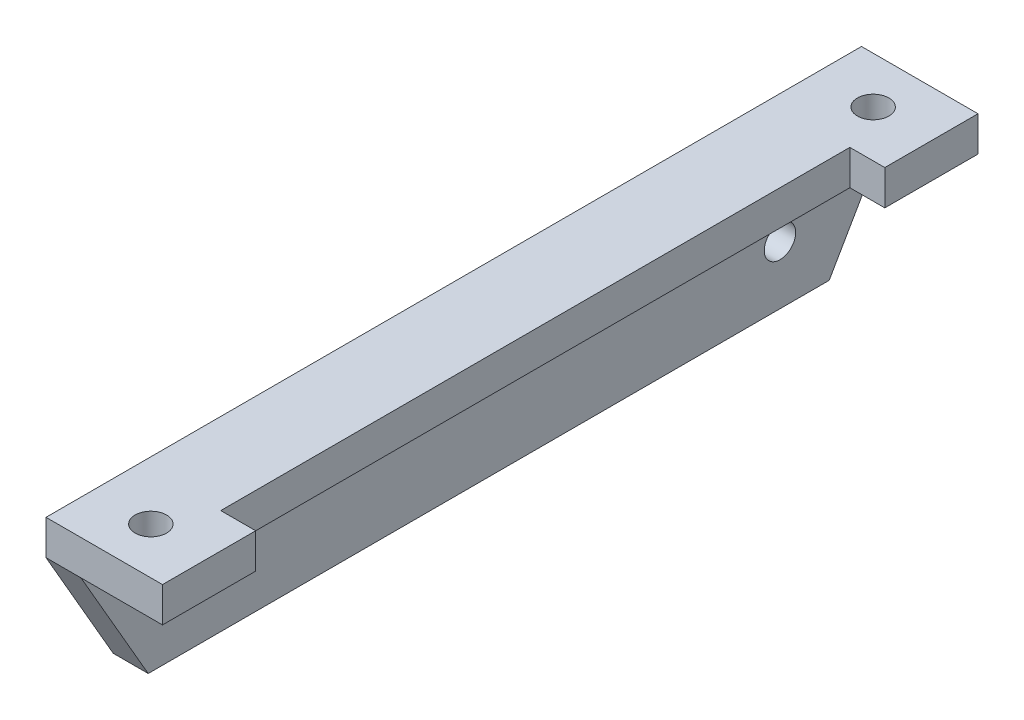
from build123d import *
from OCP.BRepFilletAPI import BRepFilletAPI_MakeChamfer

# Parameters (mm, degrees)
SKETCH1_W               = 10
SKETCH1_H               = 70
BOSS_EXTRUDE1_DEPTH     = 3
SKETCH2_W               = 3
SKETCH2_H               = 70
BOSS_EXTRUDE2_DEPTH     = 10
CUT_EXTRUDE1_DEPTH      = 39.65229618
CUT_EXTRUDE1_DEPTH_BACK = 39.65229618
SKETCH3_R               = 1.35
SKETCH4_R               = 1.35
CUT_EXTRUDE2_DEPTH      = 10
CHAMFER1_SIZE           = 10
CHAMFER1_SIZE2          = 5.773502692
SKETCH5_W               = 3
SKETCH5_H               = 54
CUT_EXTRUDE3_DEPTH      = 10


with BuildPart() as part:
    # Sketch1 → Boss-Extrude1 (new body)
    with BuildSketch(Plane(origin=(0, 0, 0), x_dir=(1, 0, 0), z_dir=(0, 1, 0))):
        with Locations((5, 0)):
            Rectangle(SKETCH1_W, SKETCH1_H)
    extrude(amount=BOSS_EXTRUDE1_DEPTH)

    # Sketch2 → Boss-Extrude2 (add)
    with BuildSketch(Plane.XZ):
        with Locations((1.5, 0)):
            Rectangle(SKETCH2_W, SKETCH2_H)
    extrude(amount=BOSS_EXTRUDE2_DEPTH)

    # Sketch3 → Cut-Extrude1 (cut, two sides: drawn at the far end of the back side and taken through both)
    with BuildSketch(Plane(origin=(0, 3, 0), x_dir=(1, 0, 0), z_dir=(0, 1, 0)).offset(-CUT_EXTRUDE1_DEPTH_BACK)):
        with Locations((5, 31)):
            Circle(SKETCH3_R)
        with Locations((5, -31)):
            Circle(SKETCH3_R)
    extrude(amount=CUT_EXTRUDE1_DEPTH + CUT_EXTRUDE1_DEPTH_BACK, mode=Mode.SUBTRACT)

    # Sketch4 → Cut-Extrude2 (cut)
    with BuildSketch(Plane(origin=(3, 0, 0), x_dir=(0, 0, -1), z_dir=(1, 0, 0))):
        with Locations((25, -5)):
            Circle(SKETCH4_R)
        with Locations((-25, -5)):
            Circle(SKETCH4_R)
    extrude(amount=-CUT_EXTRUDE2_DEPTH, mode=Mode.SUBTRACT)

    # Chamfer1: one chamfer whose edges measure the first distance from different faces: ONE call of the kernel's chamfer builder (chamfer() names one face for all edges)
    chamfer1_edges_1 = [part.edges().sort_by_distance(p)[0] for p in [
        (1.5, -10, -35),
    ]]
    chamfer1_side_1 = [part.faces().sort_by_distance(p)[0] for p in [
        (9.835987805, 1.5, -35),
    ]]
    chamfer1_edges_2 = [part.edges().sort_by_distance(p)[0] for p in [
        (1.5, -10, 35),
    ]]
    chamfer1_side_2 = [part.faces().sort_by_distance(p)[0] for p in [
        (0.164012195, -3.5, 35),
    ]]
    chamfer1 = BRepFilletAPI_MakeChamfer(part.part.solid().wrapped)
    for e in chamfer1_edges_1:
        chamfer1.Add(CHAMFER1_SIZE, CHAMFER1_SIZE2, e.wrapped, chamfer1_side_1[0].wrapped)  # the first distance lies on this face
    for e in chamfer1_edges_2:
        chamfer1.Add(CHAMFER1_SIZE, CHAMFER1_SIZE2, e.wrapped, chamfer1_side_2[0].wrapped)  # the first distance lies on this face
    add(Compound.cast(chamfer1.Shape()), mode=Mode.REPLACE)

    # Sketch5 → Cut-Extrude3 (cut)
    with BuildSketch(Plane(origin=(0, 3, 0), x_dir=(1, 0, 0), z_dir=(0, 1, 0))):
        with Locations((8.5, 0)):
            Rectangle(SKETCH5_W, SKETCH5_H)
    extrude(amount=-CUT_EXTRUDE3_DEPTH, mode=Mode.SUBTRACT)


solid = part.part
